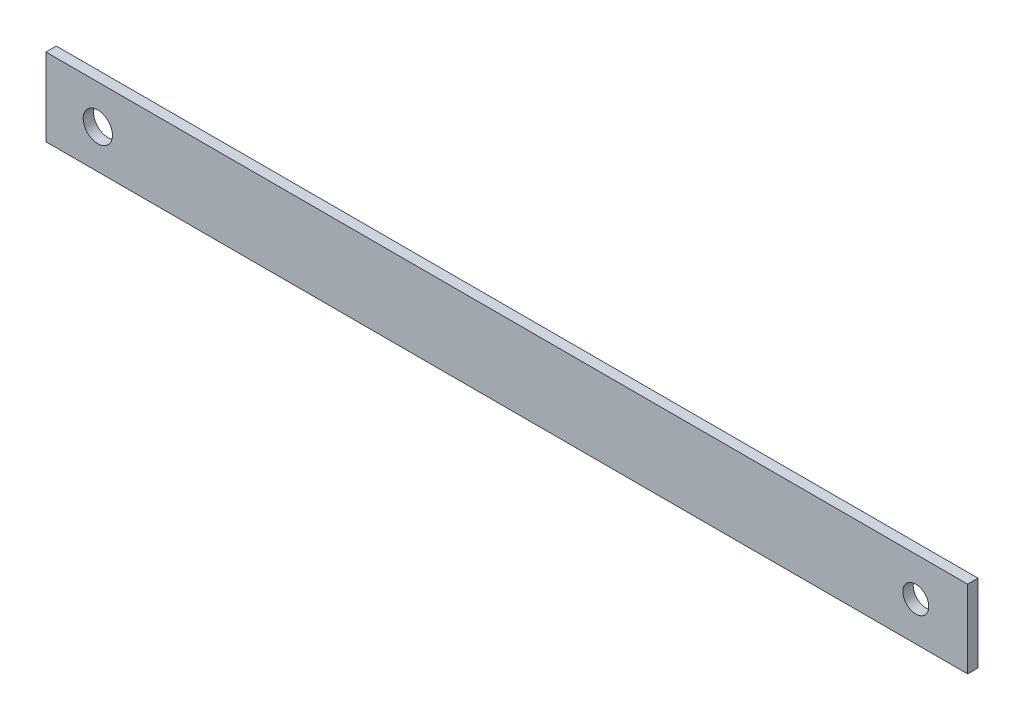
from build123d import *

# Parameters (mm, degrees)
SKETCH1_W          = 177.8
SKETCH1_H          = 15
BASE_FLANGE1_DEPTH = 2
CUT_EXTRUDE1_REACH = 180.443
SKETCH6_R          = 2.823671173
SKETCH6_R_2        = 2.5


# Sheet-metal steps are written as plain solids
with BuildPart() as part:
    # Sketch1 → Base-Flange1 (new body)
    with BuildSketch(Plane.XY):
        with Locations((88.9, 7.5)):
            Rectangle(SKETCH1_W, SKETCH1_H)
    extrude(amount=-BASE_FLANGE1_DEPTH)

    # Sketch6 → Cut-Extrude1 (cut, up to next)
    with BuildSketch(Plane.XY, mode=Mode.PRIVATE) as cut_extrude1_sk1:
        with Locations((10, 7.5)):
            Circle(SKETCH6_R)
    cut_extrude1_tool1 = extrude(cut_extrude1_sk1.sketch, amount=-CUT_EXTRUDE1_REACH, mode=Mode.PRIVATE) & part.part
    # Sketch6 → Cut-Extrude1 (cut, up to next)
    with BuildSketch(Plane.XY, mode=Mode.PRIVATE) as cut_extrude1_sk2:
        with Locations((167.8, 7.5)):
            Circle(SKETCH6_R_2)
    cut_extrude1_tool2 = extrude(cut_extrude1_sk2.sketch, amount=-CUT_EXTRUDE1_REACH, mode=Mode.PRIVATE) & part.part
    add(cut_extrude1_tool1.solids().sort_by_distance((10, 7.5, 0))[0], mode=Mode.SUBTRACT)
    add(cut_extrude1_tool2.solids().sort_by_distance((167.8, 7.5, 0))[0], mode=Mode.SUBTRACT)


solid = part.part
